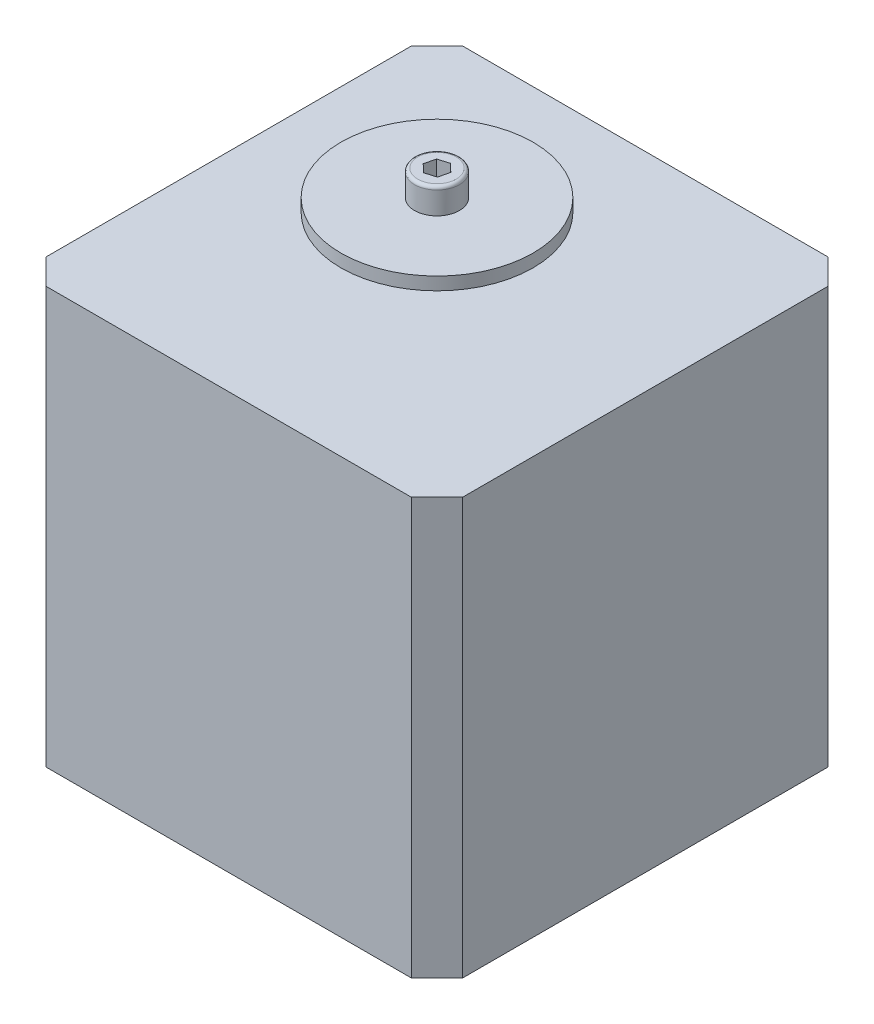
from build123d import *

# Parameters (mm, degrees)
ESQUISSE3_W             = 65
ESQUISSE3_H             = 65
BOSS_EXTRU_3_DEPTH      = 65
CHANFREIN1_SIZE         = 4
ENL_V_MAT_EXTRU_1_DEPTH = 2.5
CONG_1_R                = 0.5


with BuildPart() as part:
    # Esquisse3 → Boss.-Extru.3 (new body)
    with BuildSketch(Plane(origin=(0, 0, 0), x_dir=(1, 0, 0), z_dir=(0, 1, 0))):
        Rectangle(ESQUISSE3_W, ESQUISSE3_H)
    extrude(amount=BOSS_EXTRU_3_DEPTH)

    # Chanfrein1
    chanfrein1_edges = [part.edges().sort_by_distance(p)[0] for p in [
        (32.5, 32.5, 32.5),
        (-32.5, 32.5, 32.5),
        (32.5, 32.5, -32.5),
        (-32.5, 32.5, -32.5),
    ]]
    chamfer(chanfrein1_edges, length=CHANFREIN1_SIZE)


with BuildPart() as body_2:
    # Esquisse4 → Révolution1 (revolve)
    with BuildSketch(Plane.XY):
        Polygon((0, 65), (0, 79), (3.5, 79), (3.5, 75), (15, 75), (15, 73), (3, 73), (3, 65), align=None)
    revolve(axis=Axis((0, 79, 0), (0, 1, 0)))

    # Esquisse5 → Enlèv. mat.-Extru.1 (cut)
    with BuildSketch(Plane(origin=(0, 79, 0), x_dir=(1, 0, 0), z_dir=(0, 1, 0))):
        Polygon((1.262020142, -1.186298934), (1.658375084, 0.499792036), (0.396354942, 1.68609097), (-1.262020142, 1.186298934), (-1.658375084, -0.499792036), (-0.396354942, -1.68609097), align=None)
    extrude(amount=-ENL_V_MAT_EXTRU_1_DEPTH, mode=Mode.SUBTRACT)

    # Congé1
    cong_1_edges = [body_2.edges().sort_by_distance(p)[0] for p in [
        (-3.5, 79, 0),
    ]]
    fillet(cong_1_edges, radius=CONG_1_R)


solid = Compound([part.part, body_2.part])
